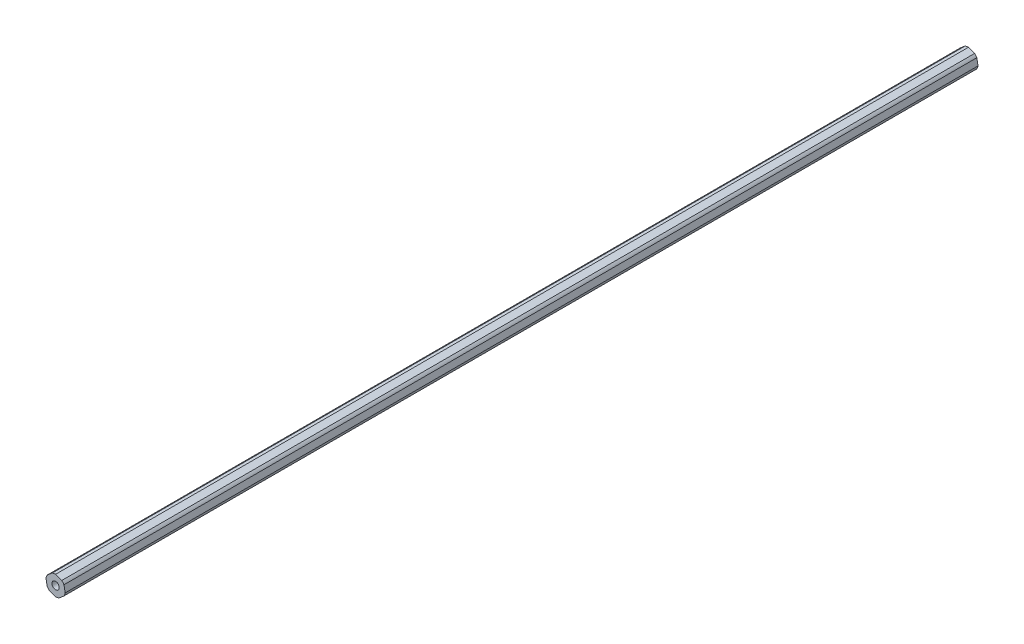
from build123d import *

# Parameters (mm, degrees)
BOSS_EXTRUDE1_DEPTH         = 635
SKETCH2_R                   = 2.0193
CUT_EXTRUDE1_DEPTH          = 636.07074048
F_1_4_20_TAPPED_HOLE1_D     = 5.1054
F_1_4_20_TAPPED_HOLE1_DEPTH = 19.05
F_1_4_20_TAPPED_HOLE1_TIP   = 1.533816902
F_1_4_20_TAPPED_HOLE2_D     = 5.1054
F_1_4_20_TAPPED_HOLE2_DEPTH = 19.05
F_1_4_20_TAPPED_HOLE2_TIP   = 1.533816902


with BuildPart() as part:
    # Sketch1 → Boss-Extrude1 (new body)
    with BuildSketch(Plane.XY):
        with BuildLine():
            Line((-6.654540832, 1.131188008), (-5.845671476, -3.375))
            ThreePointArc((-5.845671476, -3.375), (-5.15742276, -4.354709), (-4.306907968, -5.197407407))
            Line((-4.306907968, -5.197407407), (0, -6.75))
            ThreePointArc((0, -6.75), (1.19257724, -6.643813628), (2.347632865, -6.328595415))
            Line((2.347632865, -6.328595415), (5.845671476, -3.375))
            ThreePointArc((5.845671476, -3.375), (6.35, -2.289104628), (6.654540832, -1.131188008))
            Line((6.654540832, -1.131188008), (5.845671476, 3.375))
            ThreePointArc((5.845671476, 3.375), (5.15742276, 4.354709), (4.306907968, 5.197407407))
            Line((4.306907968, 5.197407407), (0, 6.75))
            ThreePointArc((0, 6.75), (-1.19257724, 6.643813628), (-2.347632865, 6.328595415))
            Line((-2.347632865, 6.328595415), (-5.845671476, 3.375))
            ThreePointArc((-5.845671476, 3.375), (-6.35, 2.289104628), (-6.654540832, 1.131188008))
        make_face()
    extrude(amount=BOSS_EXTRUDE1_DEPTH)

    # Sketch2 → Cut-Extrude1 (cut, through all)
    with BuildSketch(Plane.XY.offset(635)):
        Circle(SKETCH2_R)
    extrude(amount=-CUT_EXTRUDE1_DEPTH, mode=Mode.SUBTRACT)

    # 1/4-20 Tapped Hole1
    with Locations(Plane.XY.offset(635)):
        with Locations((0, 0)):
            Hole(F_1_4_20_TAPPED_HOLE1_D / 2, depth=F_1_4_20_TAPPED_HOLE1_DEPTH)
            with Locations((0, 0, -(F_1_4_20_TAPPED_HOLE1_DEPTH + F_1_4_20_TAPPED_HOLE1_TIP / 2))):  # 118° drill point
                Cone(0, F_1_4_20_TAPPED_HOLE1_D / 2, F_1_4_20_TAPPED_HOLE1_TIP, mode=Mode.SUBTRACT)

    # 1/4-20 Tapped Hole2
    with Locations(Plane(origin=(0, 0, 0), x_dir=(-1, 0, 0), z_dir=(0, 0, -1))):
        with Locations((0, 0)):
            Hole(F_1_4_20_TAPPED_HOLE2_D / 2, depth=F_1_4_20_TAPPED_HOLE2_DEPTH)
            with Locations((0, 0, -(F_1_4_20_TAPPED_HOLE2_DEPTH + F_1_4_20_TAPPED_HOLE2_TIP / 2))):  # 118° drill point
                Cone(0, F_1_4_20_TAPPED_HOLE2_D / 2, F_1_4_20_TAPPED_HOLE2_TIP, mode=Mode.SUBTRACT)


solid = part.part
